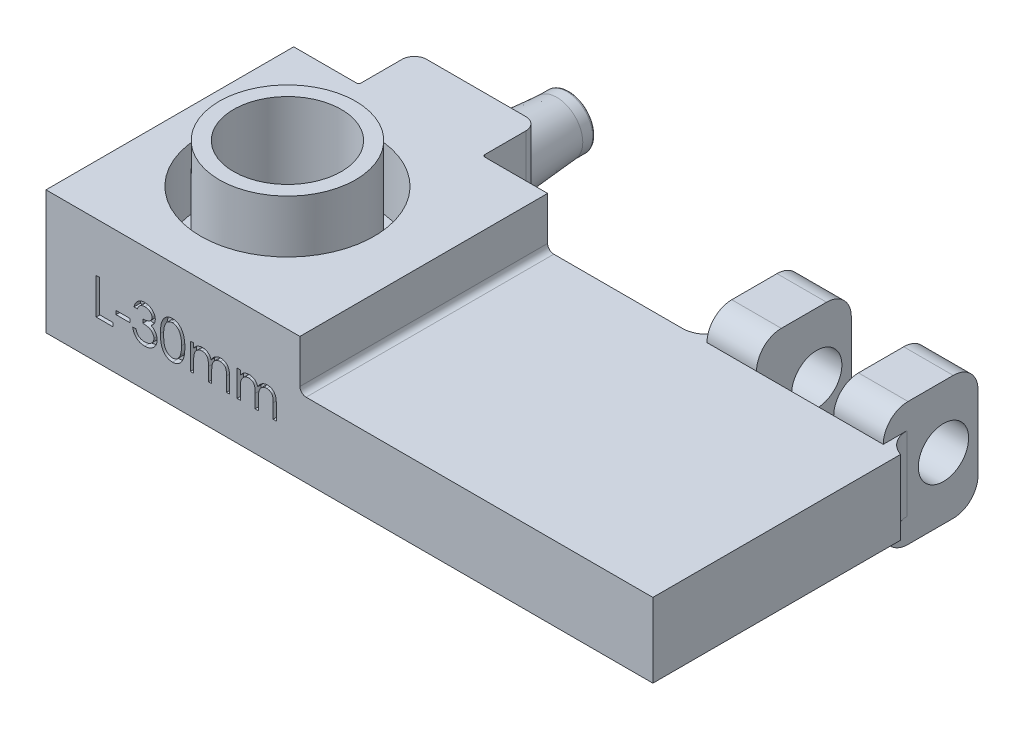
from build123d import *

# Parameters (mm, degrees)
SKETCH2_W            = 49
SKETCH2_H            = 20
BOSS_EXTRUDE1_DEPTH  = 10
SKETCH3_W            = 30
SKETCH3_H            = 3.02
CUT_EXTRUDE1_DEPTH   = 2
SKETCH4_W            = 5
SKETCH4_H            = 5
CUT_EXTRUDE2_DEPTH   = 5
SKETCH5_R            = 7
CUT_EXTRUDE3_DEPTH   = 38.474986727
SKETCH6_W            = 1.65
SKETCH6_H            = 5
BOSS_EXTRUDE2_DEPTH  = 0.5
SKETCH11_R           = 2
CUT_EXTRUDE4_DEPTH   = 2
SKETCH12_W           = 5
SKETCH12_H           = 5
BOSS_EXTRUDE4_DEPTH  = 0.8
SKETCH14_W           = 28.5
SKETCH14_H           = 4
CUT_EXTRUDE6_DEPTH   = 42.177221974
FILLET1_R            = 0.5
SKETCH13_W           = 1.119391026
SKETCH13_H           = 0.298504274
CUT_EXTRUDE5_DEPTH   = 0.5
SKETCH19_W           = 10
SKETCH19_H           = 4.49
BOSS_EXTRUDE5_DEPTH  = 10
FILLET2_R            = 1
CUT_EXTRUDE7_REACH   = 45.535
SKETCH20_R           = 0.5
SKETCH21_R           = 1.4
CUT_EXTRUDE8_DEPTH   = 10
FILLET3_R            = 0.2
BOSS_EXTRUDE6_START  = -0.5
SKETCH24_W           = 1.7
SKETCH24_H           = 3
BOSS_EXTRUDE6_DEPTH  = 0.5
SKETCH34_R           = 5.5
SKETCH34_R_2         = 4.35
BOSS_EXTRUDE10_DEPTH = 8.2
SKETCH36_W           = 4
SKETCH36_H           = 10
BOSS_EXTRUDE11_DEPTH = 7.65
CUT_EXTRUDE9_REACH   = 57.843
SKETCH37_R           = 2.03
FILLET4_R            = 2


with BuildPart() as part:
    # Sketch2 → Boss-Extrude1 (new body)
    with BuildSketch(Plane(origin=(0, 0, 0), x_dir=(1, 0, 0), z_dir=(0, 1, 0))):
        with Locations((10.076923077, 3.557692308)):
            Rectangle(SKETCH2_W, SKETCH2_H)
    extrude(amount=BOSS_EXTRUDE1_DEPTH)

    # Sketch3 → Cut-Extrude1 (cut)
    with BuildSketch(Plane.XZ):
        with Locations((12.576923077, -3.557692308)):
            Rectangle(SKETCH3_W, SKETCH3_H)
    extrude(amount=-CUT_EXTRUDE1_DEPTH, mode=Mode.SUBTRACT)

    # Sketch4 → Cut-Extrude2 (cut)
    with BuildSketch(Plane.XZ):
        with Locations((-4.923076923, -3.547692308)):
            Rectangle(SKETCH4_W, SKETCH4_H)
    extrude(amount=-CUT_EXTRUDE2_DEPTH, mode=Mode.SUBTRACT)

    # Sketch5 → Cut-Extrude3 (cut, through all)
    with BuildSketch(Plane.XZ.offset(-5)):
        with Locations(Location((-4.923076923, -3.552692308, 0), (0, 0, 270))):
            Circle(SKETCH5_R)
    extrude(amount=-CUT_EXTRUDE3_DEPTH, mode=Mode.SUBTRACT)

    # Sketch6 → Boss-Extrude2 (add)
    with BuildSketch(Plane(origin=(0, 5, 0), x_dir=(1, 0, 0), z_dir=(0, 1, 0))):
        with Locations((-3.248076923, 3.547692308)):
            Rectangle(SKETCH6_W, SKETCH6_H)
        with Locations((-6.598076923, 3.547692308)):
            Rectangle(SKETCH6_W, SKETCH6_H)
    extrude(amount=-BOSS_EXTRUDE2_DEPTH)

    # Sketch11 → Cut-Extrude4 (cut)
    with BuildSketch(Plane.XZ):
        with Locations((28.888372657, -3.557692308)):
            Circle(SKETCH11_R)
    extrude(amount=-CUT_EXTRUDE4_DEPTH, mode=Mode.SUBTRACT)

    # Sketch12 → Boss-Extrude4 (add)
    with BuildSketch(Plane.XZ):
        with Locations((-4.923076923, -3.547692308)):
            Rectangle(SKETCH12_W, SKETCH12_H)
    extrude(amount=-BOSS_EXTRUDE4_DEPTH)

    # Sketch14 → Cut-Extrude6 (cut, through all)
    with BuildSketch(Plane.XY.offset(6.442307692)):
        with Locations((20.326923077, 8)):
            Rectangle(SKETCH14_W, SKETCH14_H)
    extrude(amount=-CUT_EXTRUDE6_DEPTH, mode=Mode.SUBTRACT)

    # Fillet1
    fillet1_edges = [part.edges().sort_by_distance(p)[0] for p in [
        (6.076923077, 6, -3.557692308),
    ]]
    fillet(fillet1_edges, radius=FILLET1_R)

    # Sketch13 → Cut-Extrude5 (cut)
    # profile 1 of 6: a face of its own
    with BuildSketch(Plane.XY.offset(6.442307692)):
        Polygon((-10.374825021, 6.036177607), (-10.113633781, 6.036177607), (-10.113633781, 3.424265214), (-8.994242756, 3.424265214), (-8.994242756, 3.12576094), (-10.374825021, 3.12576094), align=None)
    # profile 2 of 6: a face of its own
    with BuildSketch(Plane.XY.offset(6.442307692)):
        with Locations((-8.210669038, 4.245151966)):
            Rectangle(SKETCH13_W, SKETCH13_H)
    # profile 3 of 6: a face of its own
    with BuildSketch(Plane.XY.offset(6.442307692)):
        with BuildLine():
            Line((-7.053964978, 5.364542992), (-7.315156217, 5.364542992))
            add(Edge.make_bspline(
                [(-7.315156217, 5.364542992), (-7.308080121, 5.39384048), (-7.294246931, 5.451114673), (-7.265394246, 5.532944996), (-7.233962365, 5.610381639), (-7.196219163, 5.681974624), (-7.155050277, 5.749162759), (-7.107882633, 5.810422144), (-7.056892363, 5.867310783), (-7.000492688, 5.917796731), (-6.941345819, 5.963513331), (-6.878618341, 6.002492173), (-6.81357228, 6.036023626), (-6.745756966, 6.063647831), (-6.674970501, 6.084457746), (-6.601852832, 6.099555994), (-6.52621235, 6.109360867), (-6.474866288, 6.110317781), (-6.448794205, 6.110803675)],
                knots=[0, 0, 0, 0, 1.162005537, 2.271625781, 3.343758855, 4.383309926, 5.390229558, 6.379919256, 7.361854164, 8.333198761, 9.295911338, 10.242430842, 11.177959212, 12.116337295, 13.062827104, 14.020064771, 14.994644689, 16, 16, 16, 16], degree=3))
            add(Edge.make_bspline(
                [(-6.448794205, 6.110803675), (-6.410806829, 6.10965678), (-6.335660693, 6.107388006), (-6.225261898, 6.086670465), (-6.118801501, 6.05388659), (-6.017444787, 6.008589092), (-5.923298269, 5.952719642), (-5.839531333, 5.886225155), (-5.767279399, 5.810388593), (-5.706664253, 5.726624669), (-5.659203673, 5.637103987), (-5.624206849, 5.54496838), (-5.602901202, 5.450436407), (-5.60014, 5.386609075), (-5.598756645, 5.354631717)],
                knots=[0, 0, 0, 0, 1.083050992, 2.142477498, 3.193116406, 4.255571735, 5.30263384, 6.308962982, 7.297363603, 8.282367274, 9.249857812, 10.179914175, 11.08814088, 12, 12, 12, 12], degree=3))
            add(Edge.make_bspline(
                [(-5.598756645, 5.354631717), (-5.599724226, 5.323858805), (-5.601617633, 5.263640992), (-5.617694529, 5.175728532), (-5.644749981, 5.092871797), (-5.682227635, 5.014721985), (-5.730741412, 4.941774604), (-5.789509125, 4.873865526), (-5.858945565, 4.810693554), (-5.911565015, 4.77450504), (-5.938655065, 4.755874122)],
                knots=[0, 0, 0, 0, 1.024540389, 2.004866551, 2.965041327, 3.920577974, 4.882998113, 5.874504559, 6.905732034, 8, 8, 8, 8], degree=3))
            add(Edge.make_bspline(
                [(-5.938655065, 4.755874122), (-5.907695089, 4.740924416), (-5.84635442, 4.711304725), (-5.762741866, 4.653216336), (-5.686839967, 4.586146742), (-5.6445111, 4.533806929), (-5.623243323, 4.507509238)],
                knots=[0, 0, 0, 0, 1.015518401, 2.012035669, 3.001164323, 4, 4, 4, 4], degree=3))
            add(Edge.make_bspline(
                [(-5.623243323, 4.507509238), (-5.609238945, 4.488335619), (-5.58145952, 4.450302364), (-5.54717021, 4.389153324), (-5.51606275, 4.32732652), (-5.491822955, 4.2631648), (-5.47305171, 4.197411823), (-5.459633831, 4.129954688), (-5.45129828, 4.060738309), (-5.45010455, 4.0139118), (-5.449504508, 3.990373905)],
                knots=[0, 0, 0, 0, 1.025084078, 2.033381695, 3.024893161, 4.013698104, 4.991890475, 5.976764909, 6.982997093, 8, 8, 8, 8], degree=3))
            add(Edge.make_bspline(
                [(-5.449504508, 3.990373905), (-5.450996731, 3.949619988), (-5.453974156, 3.868303942), (-5.480587068, 3.748166331), (-5.52184284, 3.630730601), (-5.580431137, 3.51840944), (-5.65183406, 3.413318135), (-5.736782739, 3.3192898), (-5.834311973, 3.238464532), (-5.943083099, 3.17093436), (-6.06092764, 3.116952016), (-6.186969962, 3.079484607), (-6.319393965, 3.055082011), (-6.410205034, 3.05246524), (-6.456373415, 3.051134872)],
                knots=[0, 0, 0, 0, 0.955779014, 1.907060117, 2.875433937, 3.871313158, 4.872415639, 5.851225146, 6.836215519, 7.83643374, 8.849228613, 9.86973379, 10.916971861, 12, 12, 12, 12], degree=3))
            add(Edge.make_bspline(
                [(-6.456373415, 3.051134872), (-6.487489345, 3.051856833), (-6.548715119, 3.053277411), (-6.638724743, 3.062988724), (-6.724641656, 3.080725639), (-6.806582024, 3.104593804), (-6.88461864, 3.13485527), (-6.958513375, 3.172539926), (-7.028720852, 3.216870978), (-7.094578551, 3.268371706), (-7.156078622, 3.325982439), (-7.211586691, 3.390725913), (-7.262028198, 3.461405302), (-7.306052523, 3.538841558), (-7.345664917, 3.622033953), (-7.378245749, 3.712047734), (-7.406922141, 3.808078198), (-7.42025473, 3.874999271), (-7.42709532, 3.909334658)],
                knots=[0, 0, 0, 0, 1.048658725, 2.063410685, 3.046034179, 4.001477787, 4.936774919, 5.862367409, 6.792675028, 7.730719943, 8.675894397, 9.627829632, 10.600096036, 11.597688215, 12.626045268, 13.701542398, 14.82072376, 16, 16, 16, 16], degree=3))
            Line((-7.42709532, 3.909334658), (-7.16590408, 3.909334658))
            add(Edge.make_bspline(
                [(-7.16590408, 3.909334658), (-7.159099284, 3.886925271), (-7.145863364, 3.843337065), (-7.123333165, 3.780604858), (-7.097664727, 3.723096644), (-7.070128394, 3.67039056), (-7.04120846, 3.621967544), (-7.008848847, 3.579108025), (-6.97544629, 3.539929491), (-6.950267566, 3.517856382), (-6.937944762, 3.507053509)],
                knots=[0, 0, 0, 0, 1.198163088, 2.33053128, 3.407730985, 4.417276592, 5.372219308, 6.28897303, 7.162600585, 8, 8, 8, 8], degree=3))
            add(Edge.make_bspline(
                [(-6.937944762, 3.507053509), (-6.921649276, 3.494490209), (-6.889108603, 3.469402391), (-6.836082282, 3.437386454), (-6.780314636, 3.409645173), (-6.720597315, 3.388454266), (-6.658218961, 3.370511414), (-6.592171324, 3.35876953), (-6.523037106, 3.350713354), (-6.475832008, 3.350002438), (-6.451709285, 3.349639146)],
                knots=[0, 0, 0, 0, 0.946170439, 1.889420265, 2.845303464, 3.807233317, 4.801018734, 5.828864929, 6.890507805, 8, 8, 8, 8], degree=3))
            add(Edge.make_bspline(
                [(-6.451709285, 3.349639146), (-6.424473188, 3.3501513), (-6.371215352, 3.351152774), (-6.293503186, 3.360362752), (-6.219572409, 3.373775959), (-6.150243852, 3.39449229), (-6.084609376, 3.420088034), (-6.02358904, 3.452226023), (-5.966381802, 3.489932319), (-5.913720385, 3.532789583), (-5.866367484, 3.579706743), (-5.824674091, 3.628778922), (-5.789229656, 3.679799216), (-5.760638073, 3.733049963), (-5.738061098, 3.78831065), (-5.722691436, 3.845736356), (-5.712004789, 3.904857118), (-5.711134482, 3.945044957), (-5.710695747, 3.96530421)],
                knots=[0, 0, 0, 0, 1.217147791, 2.380027433, 3.494444702, 4.572153297, 5.609568379, 6.639424714, 7.649109417, 8.668170816, 9.669597737, 10.625200337, 11.543417969, 12.441394052, 13.322311151, 14.205496177, 15.095365482, 16, 16, 16, 16], degree=3))
            add(Edge.make_bspline(
                [(-5.710695747, 3.96530421), (-5.711968266, 3.992422091), (-5.714506971, 4.046522918), (-5.733889165, 4.126116639), (-5.765769756, 4.202804798), (-5.810401005, 4.275278988), (-5.864730775, 4.342447997), (-5.928231831, 4.402378866), (-6.001431495, 4.451831079), (-6.068803374, 4.485998253), (-6.128479519, 4.509312417), (-6.179549336, 4.524841539), (-6.236723726, 4.537991347), (-6.299311279, 4.550225301), (-6.367783584, 4.560637398), (-6.442066097, 4.569320265), (-6.522173871, 4.57626788), (-6.577630751, 4.579370463), (-6.606208568, 4.580969274)],
                knots=[0, 0, 0, 0, 1.07054697, 2.135767047, 3.216561865, 4.33974944, 5.486079747, 6.621378074, 7.775625952, 8.963672916, 9.598146892, 10.304877434, 11.070270905, 11.915000392, 12.823868403, 13.805723172, 14.86925407, 16, 16, 16, 16], degree=3))
            Line((-6.606208568, 4.580969274), (-6.606208568, 4.879473547))
            add(Edge.make_bspline(
                [(-6.606208568, 4.879473547), (-6.570201586, 4.880084572), (-6.499672755, 4.881281418), (-6.396648741, 4.895757008), (-6.298132541, 4.915781197), (-6.206307446, 4.94645299), (-6.122613248, 4.982076737), (-6.050002841, 5.023531223), (-5.989493493, 5.069611226), (-5.941379257, 5.121027985), (-5.90518263, 5.176172105), (-5.878717133, 5.233645897), (-5.863083766, 5.293953107), (-5.860996859, 5.335110281), (-5.859947884, 5.355797749)],
                knots=[0, 0, 0, 0, 1.321986639, 2.589447074, 3.816329219, 5.01088745, 6.139805852, 7.153945165, 8.075214402, 8.924034688, 9.728124013, 10.488707548, 11.240355623, 12, 12, 12, 12], degree=3))
            add(Edge.make_bspline(
                [(-5.859947884, 5.355797749), (-5.860292486, 5.370996565), (-5.860978057, 5.401233887), (-5.869623888, 5.445409912), (-5.882616022, 5.488235401), (-5.90047744, 5.529528235), (-5.924384599, 5.569002028), (-5.952994815, 5.606993317), (-5.987061742, 5.643285198), (-6.026099116, 5.677112821), (-6.068018933, 5.709351287), (-6.113961752, 5.736720544), (-6.162542322, 5.760124503), (-6.21381443, 5.779424309), (-6.267944463, 5.793942539), (-6.324678095, 5.804366688), (-6.384123508, 5.810884071), (-6.424679526, 5.811822403), (-6.445296108, 5.812299402)],
                knots=[0, 0, 0, 0, 0.884392785, 1.759457502, 2.611959086, 3.489218968, 4.37281399, 5.2945488, 6.255912374, 7.266815255, 8.301784654, 9.332968512, 10.37626691, 11.440494194, 12.520033166, 13.637162961, 14.798855837, 16, 16, 16, 16], degree=3))
            add(Edge.make_bspline(
                [(-6.445296108, 5.812299402), (-6.478434667, 5.811142418), (-6.543161982, 5.80888256), (-6.636474029, 5.789089221), (-6.723220523, 5.757508636), (-6.789527021, 5.719812071), (-6.838490685, 5.682599955), (-6.873479663, 5.650101089), (-6.907839635, 5.613984628), (-6.939310118, 5.572026086), (-6.971136752, 5.527066976), (-7.000111664, 5.476821807), (-7.02826761, 5.422601248), (-7.045233302, 5.384270533), (-7.053964978, 5.364542992)],
                knots=[0, 0, 0, 0, 1.472543308, 2.876219568, 4.221790263, 5.565193594, 6.249813518, 6.953379497, 7.687249741, 8.463570142, 9.283606569, 10.136032583, 11.040678096, 12, 12, 12, 12], degree=3))
        make_face()
    # profile 4 of 6: a face of its own
    with BuildSketch(Plane.XY.offset(6.442307692)):
        with BuildLine():
            add(Edge.make_bspline(
                [(-5.188313269, 4.579803241), (-5.188040506, 4.626450891), (-5.18751066, 4.717064622), (-5.181616301, 4.849101613), (-5.171824543, 4.972969186), (-5.158405549, 5.088673272), (-5.142075633, 5.196243739), (-5.120276208, 5.295393117), (-5.095485443, 5.386580302), (-5.066753439, 5.470102648), (-5.034333236, 5.547085417), (-4.999047127, 5.618952087), (-4.959494735, 5.68559392), (-4.917936553, 5.748074571), (-4.872690324, 5.805371274), (-4.825043651, 5.858293179), (-4.773136889, 5.905617178), (-4.718734542, 5.948729847), (-4.661344065, 5.986523247), (-4.602601324, 6.019812376), (-4.542101989, 6.048251194), (-4.479680884, 6.070611872), (-4.415899054, 6.089081248), (-4.350533535, 6.101711582), (-4.283476401, 6.109658606), (-4.238214071, 6.110418364), (-4.215259299, 6.110803675)],
                knots=[0, 0, 0, 0, 1.646270934, 3.197905019, 4.663502075, 6.030701355, 7.308322542, 8.50163776, 9.611534131, 10.641858119, 11.616356847, 12.558055219, 13.465016945, 14.349605745, 15.204443733, 16.039544428, 16.859896111, 17.680448484, 18.487036065, 19.28249412, 20.06191084, 20.843045899, 21.620316918, 22.403196591, 23.190181807, 24, 24, 24, 24], degree=3))
            add(Edge.make_bspline(
                [(-4.215259299, 6.110803675), (-4.192112773, 6.110398034), (-4.146081616, 6.109591341), (-4.078027446, 6.101838038), (-4.011545479, 6.088973063), (-3.946919146, 6.070744729), (-3.883617594, 6.048130228), (-3.822135951, 6.019785167), (-3.762092324, 5.9867903), (-3.704440888, 5.948020325), (-3.648548735, 5.904794587), (-3.595788733, 5.85593063), (-3.546156078, 5.801921846), (-3.499027863, 5.743346081), (-3.455741155, 5.679079853), (-3.414518486, 5.610240924), (-3.377621025, 5.535625437), (-3.342085107, 5.456478345), (-3.311411821, 5.370609696), (-3.283749354, 5.278503523), (-3.261398212, 5.179071893), (-3.242780466, 5.072836491), (-3.228357359, 4.959407173), (-3.217852716, 4.839027088), (-3.212303728, 4.711617037), (-3.211258721, 4.624505897), (-3.210722457, 4.579803241)],
                knots=[0, 0, 0, 0, 0.810914788, 1.612654377, 2.396697861, 3.181598691, 3.963628158, 4.749916497, 5.551656086, 6.361998678, 7.18212741, 8.025565596, 8.878627764, 9.750805457, 10.657531673, 11.591944965, 12.560506719, 13.57287815, 14.630710178, 15.753379473, 16.941251878, 18.199788006, 19.531962791, 20.947069417, 22.433333509, 24, 24, 24, 24], degree=3))
            add(Edge.make_bspline(
                [(-3.210722457, 4.579803241), (-3.21126428, 4.535295563), (-3.212320001, 4.448574167), (-3.217790509, 4.321737398), (-3.228566228, 4.201996168), (-3.242045605, 4.089063301), (-3.26071465, 3.983408841), (-3.28366966, 3.884667177), (-3.309156863, 3.792411899), (-3.340618296, 3.707398785), (-3.375053274, 3.628441906), (-3.412518815, 3.554710949), (-3.452657474, 3.485554217), (-3.49638752, 3.421525261), (-3.542998602, 3.362170508), (-3.593488335, 3.308537664), (-3.646433458, 3.259334432), (-3.702490092, 3.215552097), (-3.76104065, 3.177230387), (-3.820878049, 3.142959108), (-3.883063993, 3.11532454), (-3.946189228, 3.091596294), (-4.011156685, 3.07346818), (-4.07788538, 3.060933552), (-4.146035893, 3.052142556), (-4.192104933, 3.05147193), (-4.215259299, 3.051134872)],
                knots=[0, 0, 0, 0, 1.561518951, 3.042555995, 4.452378317, 5.7783523, 7.031515105, 8.214008947, 9.334062868, 10.386615937, 11.391082383, 12.354592575, 13.286541444, 14.194233754, 15.072674879, 15.931287219, 16.775624067, 17.606195743, 18.42308326, 19.229000347, 20.022332153, 20.807536673, 21.593273796, 22.3848459, 23.188221202, 24, 24, 24, 24], degree=3))
            add(Edge.make_bspline(
                [(-4.215259299, 3.051134872), (-4.238213434, 3.051522669), (-4.283474508, 3.052287328), (-4.350540841, 3.060198449), (-4.41563642, 3.072917388), (-4.479082467, 3.090726315), (-4.541204492, 3.112525199), (-4.601155988, 3.140925614), (-4.659603544, 3.173633765), (-4.716391225, 3.210883291), (-4.770451932, 3.253559714), (-4.82208988, 3.300761924), (-4.870007827, 3.35366782), (-4.914607132, 3.411442021), (-4.956994513, 3.473553009), (-4.99598526, 3.540848805), (-5.03205019, 3.613062571), (-5.065015641, 3.690660857), (-5.094243428, 3.774775997), (-5.120061076, 3.866370284), (-5.140445765, 3.966252155), (-5.157894092, 4.073619394), (-5.171967522, 4.188933371), (-5.181575494, 4.312256688), (-5.187513837, 4.443512495), (-5.188041929, 4.533543968), (-5.188313269, 4.579803241)],
                knots=[0, 0, 0, 0, 0.810891512, 1.598919785, 2.382837074, 3.152667961, 3.926044502, 4.706494248, 5.493654104, 6.291793342, 7.103789334, 7.925228297, 8.761435821, 9.622817696, 10.50288917, 11.416980706, 12.369136599, 13.353924996, 14.394355917, 15.514179734, 16.714354668, 17.994756427, 19.357759367, 20.818452758, 22.365282078, 24, 24, 24, 24], degree=3))
        make_face()
        with BuildLine():
            add(Edge.make_bspline(
                [(-4.927122029, 4.580969274), (-4.927022703, 4.542095505), (-4.926829931, 4.466649152), (-4.921793912, 4.357015202), (-4.914933451, 4.254759518), (-4.906084706, 4.159752262), (-4.892943802, 4.072315019), (-4.878219764, 3.99184642), (-4.860301502, 3.918772312), (-4.83910118, 3.852591258), (-4.814953788, 3.792180098), (-4.788588853, 3.735966468), (-4.76026574, 3.683286317), (-4.728567851, 3.634612834), (-4.694046099, 3.589787291), (-4.65748024, 3.548016299), (-4.617505597, 3.510765476), (-4.562204568, 3.466089038), (-4.489197619, 3.419922234), (-4.397211443, 3.379720158), (-4.302690713, 3.354455699), (-4.238535775, 3.351242802), (-4.206514056, 3.349639146)],
                knots=[0, 0, 0, 0, 1.459021318, 2.831673884, 4.118529203, 5.306027144, 6.411944654, 7.436330062, 8.375795394, 9.233974572, 10.042671642, 10.816086306, 11.563610507, 12.285937304, 12.993564865, 13.685989202, 14.367179055, 15.041617293, 16.353048772, 17.594441528, 18.799311195, 20, 20, 20, 20], degree=3))
            add(Edge.make_bspline(
                [(-4.206514056, 3.349639146), (-4.174285207, 3.350967776), (-4.109894048, 3.353622295), (-4.01581791, 3.379232912), (-3.924488811, 3.417874547), (-3.852915894, 3.463566014), (-3.798464041, 3.507079512), (-3.759450329, 3.544178716), (-3.723642185, 3.585719399), (-3.689680055, 3.63053923), (-3.65853105, 3.679494504), (-3.630205929, 3.732349812), (-3.604358645, 3.789251932), (-3.58963273, 3.828974745), (-3.58210375, 3.849283994)],
                knots=[0, 0, 0, 0, 1.353760809, 2.704726607, 4.075137775, 5.516104923, 6.260822281, 7.007110065, 7.778089737, 8.566572457, 9.372053459, 10.217411131, 11.088608312, 12, 12, 12, 12], degree=3))
            add(Edge.make_bspline(
                [(-3.58210375, 3.849283994), (-3.573329453, 3.875253009), (-3.555513866, 3.927981248), (-3.532553361, 4.009775309), (-3.514471026, 4.095593321), (-3.498203156, 4.184922421), (-3.487099454, 4.278421387), (-3.478162135, 4.375800922), (-3.472897868, 4.477134447), (-3.47224531, 4.545982425), (-3.471913696, 4.580969274)],
                knots=[0, 0, 0, 0, 0.884706709, 1.796334032, 2.740027952, 3.714592787, 4.726048262, 5.777819803, 6.87074269, 8, 8, 8, 8], degree=3))
            add(Edge.make_bspline(
                [(-3.471913696, 4.580969274), (-3.472371204, 4.615950464), (-3.473266189, 4.684381149), (-3.476687166, 4.784597755), (-3.485521174, 4.879783149), (-3.495332703, 4.970347393), (-3.509799321, 5.055789163), (-3.52539733, 5.136823732), (-3.546353338, 5.212447188), (-3.568738413, 5.283843519), (-3.594358724, 5.350201563), (-3.622561272, 5.411830705), (-3.65268139, 5.46902848), (-3.685396336, 5.521637954), (-3.720317746, 5.569894777), (-3.758367327, 5.612831401), (-3.798035785, 5.651778571), (-3.853597457, 5.696235243), (-3.926336494, 5.741564313), (-4.016846833, 5.783279531), (-4.111036768, 5.807234999), (-4.174711241, 5.810612485), (-4.206514056, 5.812299402)],
                knots=[0, 0, 0, 0, 1.31362396, 2.569729283, 3.763502607, 4.902122613, 5.988968491, 7.01645872, 7.998833611, 8.933434873, 9.825090667, 10.667526885, 11.477055099, 12.250526234, 12.991942729, 13.710640831, 14.402115721, 15.076753259, 16.378508321, 17.609869233, 18.806226677, 20, 20, 20, 20], degree=3))
            add(Edge.make_bspline(
                [(-4.206514056, 5.812299402), (-4.238703757, 5.810610157), (-4.3031418, 5.807228591), (-4.398310725, 5.783368784), (-4.489535117, 5.741780621), (-4.562081805, 5.696085107), (-4.617682227, 5.652563309), (-4.656833729, 5.614822311), (-4.693543373, 5.573539086), (-4.727360503, 5.528301303), (-4.759033555, 5.479684566), (-4.788121933, 5.427306409), (-4.814330094, 5.3709014), (-4.83851527, 5.310517376), (-4.859780261, 5.244342031), (-4.877320896, 5.171357933), (-4.893525309, 5.091145277), (-4.904996732, 5.003234472), (-4.915194629, 4.908203419), (-4.921748345, 4.805692459), (-4.926846777, 4.695874637), (-4.927028441, 4.620038194), (-4.927122029, 4.580969274)],
                knots=[0, 0, 0, 0, 1.207732386, 2.417664972, 3.655092373, 4.956220595, 5.625982001, 6.301752483, 6.994047911, 7.697131622, 8.419323945, 9.170223765, 9.943494443, 10.752040957, 11.610060368, 12.549350801, 13.567764191, 14.679664412, 15.874934091, 17.154273443, 18.533957287, 20, 20, 20, 20], degree=3))
        make_face(mode=Mode.SUBTRACT)
    # profile 5 of 6: a face of its own
    with BuildSketch(Plane.XY.offset(6.442307692)):
        with BuildLine():
            Line((-2.762966046, 5.252603889), (-2.501774807, 5.252603889))
            Line((-2.501774807, 5.252603889), (-2.501774807, 4.882971644))
            add(Edge.make_bspline(
                [(-2.501774807, 4.882971644), (-2.478255356, 4.915308537), (-2.433189832, 4.977269123), (-2.359293811, 5.05891902), (-2.285472246, 5.128210349), (-2.232308594, 5.16458463), (-2.20676863, 5.182058934)],
                knots=[0, 0, 0, 0, 1.134379233, 2.173579362, 3.122582517, 4, 4, 4, 4], degree=3))
            add(Edge.make_bspline(
                [(-2.20676863, 5.182058934), (-2.17195617, 5.198694348), (-2.102939464, 5.231674535), (-1.993658121, 5.265130655), (-1.88183603, 5.285690755), (-1.806324675, 5.288502528), (-1.768340479, 5.289916923)],
                knots=[0, 0, 0, 0, 1.014936303, 2.012140481, 3.000054389, 4, 4, 4, 4], degree=3))
            add(Edge.make_bspline(
                [(-1.768340479, 5.289916923), (-1.742651481, 5.289047714), (-1.691814336, 5.287327596), (-1.616489351, 5.276134936), (-1.543430732, 5.256788005), (-1.473070137, 5.229839772), (-1.406778596, 5.197204283), (-1.346001448, 5.158911758), (-1.291431794, 5.115923178), (-1.243097214, 5.066297304), (-1.199633031, 5.00864062), (-1.15965318, 4.941398147), (-1.122711501, 4.86305999), (-1.10223771, 4.806209956), (-1.091458718, 4.776279687)],
                knots=[0, 0, 0, 0, 1.009824226, 1.998387844, 2.986035974, 3.974953746, 4.955485308, 5.885931332, 6.793869504, 7.679848016, 8.601185859, 9.625726857, 10.749998409, 12, 12, 12, 12], degree=3))
            add(Edge.make_bspline(
                [(-1.091458718, 4.776279687), (-1.080057159, 4.796839219), (-1.057620494, 4.837297491), (-1.019946699, 4.894556415), (-0.980474966, 4.948113729), (-0.938868902, 4.998011928), (-0.895275362, 5.044004603), (-0.849489186, 5.086243814), (-0.801771007, 5.124910956), (-0.73541996, 5.17008325), (-0.649094834, 5.21806453), (-0.540255134, 5.259665564), (-0.427039783, 5.285373797), (-0.350190066, 5.288392541), (-0.311383097, 5.289916923)],
                knots=[0, 0, 0, 0, 0.86119277, 1.694706429, 2.50939023, 3.298075842, 4.073795165, 4.829715201, 5.57930267, 6.321991688, 7.768977793, 9.186738141, 10.579381044, 12, 12, 12, 12], degree=3))
            add(Edge.make_bspline(
                [(-0.311383097, 5.289916923), (-0.275725119, 5.288572127), (-0.205938993, 5.285940231), (-0.104342778, 5.265273384), (-0.009594742, 5.229784888), (0.07811447, 5.181360846), (0.157244386, 5.120508871), (0.226026936, 5.048106986), (0.284044316, 4.964667317), (0.321945125, 4.886175883), (0.347652639, 4.816878586), (0.363502963, 4.757833473), (0.377505972, 4.692846735), (0.389132043, 4.621840667), (0.397629256, 4.544564441), (0.403924666, 4.461144518), (0.408185577, 4.371516065), (0.408486658, 4.309677611), (0.40864186, 4.277800871)],
                knots=[0, 0, 0, 0, 1.209669288, 2.367440248, 3.500751976, 4.631527125, 5.755587489, 6.87532382, 8.007944318, 9.190864318, 9.82315674, 10.514484317, 11.263564316, 12.079023757, 12.955305781, 13.901327259, 14.918167583, 16, 16, 16, 16], degree=3))
            Line((0.40864186, 4.277800871), (0.40864186, 3.12576094))
            Line((0.40864186, 3.12576094), (0.14745062, 3.12576094))
            Line((0.14745062, 3.12576094), (0.14745062, 4.278966903))
            add(Edge.make_bspline(
                [(0.14745062, 4.278966903), (0.147385857, 4.306175619), (0.147261392, 4.358466632), (0.145021509, 4.433515843), (0.140801143, 4.501925899), (0.135866209, 4.563603522), (0.129011089, 4.618692545), (0.120158489, 4.667082312), (0.110780561, 4.709153475), (0.095200693, 4.755791695), (0.070297595, 4.807239721), (0.032364488, 4.862723551), (-0.015424642, 4.911020502), (-0.070606272, 4.952945734), (-0.133428402, 4.987033898), (-0.202666984, 5.011378295), (-0.277892151, 5.026448331), (-0.329965981, 5.027950119), (-0.356858357, 5.028725684)],
                knots=[0, 0, 0, 0, 1.253487763, 2.409012846, 3.458416907, 4.410876679, 5.259312806, 6.014470957, 6.676830364, 7.243083969, 8.276244668, 9.299465089, 10.325150304, 11.392391894, 12.482080715, 13.603491619, 14.762376348, 16, 16, 16, 16], degree=3))
            add(Edge.make_bspline(
                [(-0.356858357, 5.028725684), (-0.389845813, 5.027548082), (-0.455041568, 5.025220692), (-0.550208439, 5.001460156), (-0.641654576, 4.965636876), (-0.726651327, 4.913721315), (-0.804839912, 4.851514598), (-0.872111763, 4.777548774), (-0.927685908, 4.693870197), (-0.965316744, 4.616414279), (-0.989090109, 4.546839152), (-1.004787164, 4.486055206), (-1.016997103, 4.416968926), (-1.028447954, 4.340044543), (-1.035921678, 4.254752553), (-1.042714068, 4.161487502), (-1.045891298, 4.059968876), (-1.046335725, 3.989597755), (-1.046566474, 3.95306087)],
                knots=[0, 0, 0, 0, 1.090531906, 2.155305635, 3.229839962, 4.33261226, 5.44038871, 6.529323825, 7.629011124, 8.757537029, 9.370236727, 10.061839251, 10.834451254, 11.692844982, 12.636905849, 13.66920014, 14.789842145, 16, 16, 16, 16], degree=3))
            Line((-1.046566474, 3.95306087), (-1.046566474, 3.12576094))
            Line((-1.046566474, 3.12576094), (-1.307757713, 3.12576094))
            Line((-1.307757713, 3.12576094), (-1.307757713, 4.207255916))
            add(Edge.make_bspline(
                [(-1.307757713, 4.207255916), (-1.307823764, 4.237768158), (-1.307950838, 4.296470644), (-1.310176324, 4.380651266), (-1.314406092, 4.457221069), (-1.319296048, 4.52609106), (-1.326331089, 4.587136075), (-1.334322064, 4.640683383), (-1.343758974, 4.686598741), (-1.359383658, 4.736960079), (-1.383261106, 4.792441704), (-1.421668845, 4.851598851), (-1.469572291, 4.903377739), (-1.525760692, 4.94758177), (-1.588963036, 4.984121204), (-1.658799233, 5.010447795), (-1.734640461, 5.025768469), (-1.786926268, 5.027721356), (-1.813815739, 5.028725684)],
                knots=[0, 0, 0, 0, 1.320475261, 2.540461679, 3.643808994, 4.639130445, 5.527981419, 6.302341397, 6.981980563, 7.553956391, 8.582137848, 9.585246428, 10.591171744, 11.620968678, 12.668337649, 13.738356861, 14.836885341, 16, 16, 16, 16], degree=3))
            add(Edge.make_bspline(
                [(-1.813815739, 5.028725684), (-1.845428029, 5.027453034), (-1.908430201, 5.024916687), (-2.000983089, 5.002087151), (-2.090362553, 4.966327215), (-2.17514274, 4.916717234), (-2.253037255, 4.855266631), (-2.321231034, 4.782992757), (-2.378560027, 4.700795078), (-2.416588209, 4.624155894), (-2.441117595, 4.556323831), (-2.457412049, 4.498655216), (-2.471415, 4.434625843), (-2.481821005, 4.364038168), (-2.491866446, 4.287351936), (-2.496714625, 4.204185126), (-2.501430799, 4.11460908), (-2.501657325, 4.052764767), (-2.501774807, 4.020690745)],
                knots=[0, 0, 0, 0, 1.098833095, 2.189935336, 3.297829714, 4.440610912, 5.596351641, 6.740013378, 7.886572111, 9.072425424, 9.705826452, 10.395263256, 11.156850408, 11.985370555, 12.878090359, 13.847760091, 14.883794034, 16, 16, 16, 16], degree=3))
            Line((-2.501774807, 4.020690745), (-2.501774807, 3.12576094))
            Line((-2.501774807, 3.12576094), (-2.762966046, 3.12576094))
            Line((-2.762966046, 3.12576094), (-2.762966046, 5.252603889))
        make_face()
    # profile 6 of 6: a face of its own
    with BuildSketch(Plane.XY.offset(6.442307692)):
        with BuildLine():
            Line((1.005650407, 5.252603889), (1.266841646, 5.252603889))
            Line((1.266841646, 5.252603889), (1.266841646, 4.882971644))
            add(Edge.make_bspline(
                [(1.266841646, 4.882971644), (1.290361097, 4.915308537), (1.335426621, 4.977269123), (1.409322642, 5.05891902), (1.483144207, 5.128210349), (1.536307859, 5.16458463), (1.561847823, 5.182058934)],
                knots=[0, 0, 0, 0, 1.134379233, 2.173579362, 3.122582517, 4, 4, 4, 4], degree=3))
            add(Edge.make_bspline(
                [(1.561847823, 5.182058934), (1.596660283, 5.198694348), (1.665676989, 5.231674535), (1.774958332, 5.265130655), (1.886780423, 5.285690755), (1.962291778, 5.288502528), (2.000275974, 5.289916923)],
                knots=[0, 0, 0, 0, 1.014936303, 2.012140481, 3.000054389, 4, 4, 4, 4], degree=3))
            add(Edge.make_bspline(
                [(2.000275974, 5.289916923), (2.025964972, 5.289047714), (2.076802117, 5.287327596), (2.152127102, 5.276134936), (2.225185721, 5.256788005), (2.295546316, 5.229839772), (2.361837857, 5.197204283), (2.422615005, 5.158911758), (2.477184659, 5.115923178), (2.525519239, 5.066297304), (2.568983422, 5.00864062), (2.608963273, 4.941398147), (2.645904952, 4.86305999), (2.666378743, 4.806209956), (2.677157735, 4.776279687)],
                knots=[0, 0, 0, 0, 1.009824226, 1.998387844, 2.986035974, 3.974953746, 4.955485308, 5.885931332, 6.793869504, 7.679848016, 8.601185859, 9.625726857, 10.749998409, 12, 12, 12, 12], degree=3))
            add(Edge.make_bspline(
                [(2.677157735, 4.776279687), (2.688559294, 4.796839219), (2.710995959, 4.837297491), (2.748669754, 4.894556415), (2.788141487, 4.948113729), (2.829747551, 4.998011928), (2.873341091, 5.044004603), (2.919127267, 5.086243814), (2.966845446, 5.124910956), (3.033196493, 5.17008325), (3.119521619, 5.21806453), (3.228361319, 5.259665564), (3.34157667, 5.285373797), (3.418426387, 5.288392541), (3.457233356, 5.289916923)],
                knots=[0, 0, 0, 0, 0.86119277, 1.694706429, 2.50939023, 3.298075842, 4.073795165, 4.829715201, 5.57930267, 6.321991688, 7.768977793, 9.186738141, 10.579381044, 12, 12, 12, 12], degree=3))
            add(Edge.make_bspline(
                [(3.457233356, 5.289916923), (3.492891334, 5.288572127), (3.56267746, 5.285940231), (3.664273675, 5.265273384), (3.759021711, 5.229784888), (3.846730923, 5.181360846), (3.925860839, 5.120508871), (3.994643389, 5.048106986), (4.052660769, 4.964667317), (4.090561578, 4.886175883), (4.116269092, 4.816878586), (4.132119416, 4.757833473), (4.146122425, 4.692846735), (4.157748496, 4.621840667), (4.166245709, 4.544564441), (4.172541119, 4.461144518), (4.17680203, 4.371516065), (4.177103111, 4.309677611), (4.177258313, 4.277800871)],
                knots=[0, 0, 0, 0, 1.209669288, 2.367440248, 3.500751976, 4.631527125, 5.755587489, 6.87532382, 8.007944318, 9.190864318, 9.82315674, 10.514484317, 11.263564316, 12.079023757, 12.955305781, 13.901327259, 14.918167583, 16, 16, 16, 16], degree=3))
            Line((4.177258313, 4.277800871), (4.177258313, 3.12576094))
            Line((4.177258313, 3.12576094), (3.916067073, 3.12576094))
            Line((3.916067073, 3.12576094), (3.916067073, 4.278966903))
            add(Edge.make_bspline(
                [(3.916067073, 4.278966903), (3.91600231, 4.306175619), (3.915877845, 4.358466632), (3.913637962, 4.433515843), (3.909417596, 4.501925899), (3.904482662, 4.563603522), (3.897627542, 4.618692545), (3.888774942, 4.667082312), (3.879397014, 4.709153475), (3.863817146, 4.755791695), (3.838914048, 4.807239721), (3.800980941, 4.862723551), (3.753191811, 4.911020502), (3.698010181, 4.952945734), (3.635188051, 4.987033898), (3.565949469, 5.011378295), (3.490724302, 5.026448331), (3.438650472, 5.027950119), (3.411758096, 5.028725684)],
                knots=[0, 0, 0, 0, 1.253487763, 2.409012846, 3.458416907, 4.410876679, 5.259312806, 6.014470957, 6.676830364, 7.243083969, 8.276244668, 9.299465089, 10.325150304, 11.392391894, 12.482080715, 13.603491619, 14.762376348, 16, 16, 16, 16], degree=3))
            add(Edge.make_bspline(
                [(3.411758096, 5.028725684), (3.37877064, 5.027548082), (3.313574885, 5.025220692), (3.218408014, 5.001460156), (3.126961877, 4.965636876), (3.041965126, 4.913721315), (2.963776541, 4.851514598), (2.89650469, 4.777548774), (2.840930545, 4.693870197), (2.803299709, 4.616414279), (2.779526344, 4.546839152), (2.763829289, 4.486055206), (2.75161935, 4.416968926), (2.740168499, 4.340044543), (2.732694775, 4.254752553), (2.725902385, 4.161487502), (2.722725155, 4.059968876), (2.722280728, 3.989597755), (2.722049979, 3.95306087)],
                knots=[0, 0, 0, 0, 1.090531906, 2.155305635, 3.229839962, 4.33261226, 5.44038871, 6.529323825, 7.629011124, 8.757537029, 9.370236727, 10.061839251, 10.834451254, 11.692844982, 12.636905849, 13.66920014, 14.789842145, 16, 16, 16, 16], degree=3))
            Line((2.722049979, 3.95306087), (2.722049979, 3.12576094))
            Line((2.722049979, 3.12576094), (2.46085874, 3.12576094))
            Line((2.46085874, 3.12576094), (2.46085874, 4.207255916))
            add(Edge.make_bspline(
                [(2.46085874, 4.207255916), (2.460792689, 4.237768158), (2.460665615, 4.296470644), (2.458440129, 4.380651266), (2.454210361, 4.457221069), (2.449320405, 4.52609106), (2.442285364, 4.587136075), (2.434294389, 4.640683383), (2.424857479, 4.686598741), (2.409232795, 4.736960079), (2.385355347, 4.792441704), (2.346947608, 4.851598851), (2.299044162, 4.903377739), (2.242855761, 4.94758177), (2.179653417, 4.984121204), (2.10981722, 5.010447795), (2.033975992, 5.025768469), (1.981690185, 5.027721356), (1.954800714, 5.028725684)],
                knots=[0, 0, 0, 0, 1.320475261, 2.540461679, 3.643808994, 4.639130445, 5.527981419, 6.302341397, 6.981980563, 7.553956391, 8.582137848, 9.585246428, 10.591171744, 11.620968678, 12.668337649, 13.738356861, 14.836885341, 16, 16, 16, 16], degree=3))
            add(Edge.make_bspline(
                [(1.954800714, 5.028725684), (1.923188424, 5.027453034), (1.860186252, 5.024916687), (1.767633364, 5.002087151), (1.6782539, 4.966327215), (1.593473713, 4.916717234), (1.515579198, 4.855266631), (1.447385419, 4.782992757), (1.390056426, 4.700795078), (1.352028244, 4.624155894), (1.327498858, 4.556323831), (1.311204404, 4.498655216), (1.297201453, 4.434625843), (1.286795448, 4.364038168), (1.276750007, 4.287351936), (1.271901828, 4.204185126), (1.267185654, 4.11460908), (1.266959128, 4.052764767), (1.266841646, 4.020690745)],
                knots=[0, 0, 0, 0, 1.098833095, 2.189935336, 3.297829714, 4.440610912, 5.596351641, 6.740013378, 7.886572111, 9.072425424, 9.705826452, 10.395263256, 11.156850408, 11.985370555, 12.878090359, 13.847760091, 14.883794034, 16, 16, 16, 16], degree=3))
            Line((1.266841646, 4.020690745), (1.266841646, 3.12576094))
            Line((1.266841646, 3.12576094), (1.005650407, 3.12576094))
            Line((1.005650407, 3.12576094), (1.005650407, 5.252603889))
        make_face()
    extrude(amount=-CUT_EXTRUDE5_DEPTH, mode=Mode.SUBTRACT)

    # Sketch19 → Boss-Extrude5 (add)
    with BuildSketch(Plane(origin=(0, 10, 0), x_dir=(1, 0, 0), z_dir=(0, 1, 0))):
        with Locations((-4.173076923, 15.802692308)):
            Rectangle(SKETCH19_W, SKETCH19_H)
    extrude(amount=-BOSS_EXTRUDE5_DEPTH)

    # Fillet2
    fillet2_edges = [part.edges().sort_by_distance(p)[0] for p in [
        (-9.173076923, 5, -18.047692308),
        (0.826923077, 5, -18.047692308),
    ]]
    fillet(fillet2_edges, radius=FILLET2_R)

    # Sketch20 → Cut-Extrude7 (cut, up to next)
    with BuildSketch(Plane(origin=(0, 0, -18.047692308), x_dir=(-1, 0, 0), z_dir=(0, 0, -1)), mode=Mode.PRIVATE) as cut_extrude7_sk1:
        with Locations((4.673076923, 3.5)):
            Circle(SKETCH20_R)
    cut_extrude7_tool1 = extrude(cut_extrude7_sk1.sketch, amount=-CUT_EXTRUDE7_REACH, mode=Mode.PRIVATE) & part.part
    add(cut_extrude7_tool1.solids().sort_by_distance((-4.673077, 3.5, -18.047692))[0], mode=Mode.SUBTRACT)

    # Sketch21 → Cut-Extrude8 (cut)
    with BuildSketch(Plane(origin=(0, 0, -18.047692308), x_dir=(-1, 0, 0), z_dir=(0, 0, -1))):
        with Locations((4.673076923, 3.5)):
            Circle(SKETCH21_R)
    extrude(amount=-CUT_EXTRUDE8_DEPTH, mode=Mode.SUBTRACT)

    # Sketch23 → Revolve1 (revolve)
    with BuildSketch(Plane(origin=(0, 3.5, 0), x_dir=(-1, 0, 0), z_dir=(0, -1, 0)), mode=Mode.PRIVATE) as revolve1_sk:
        with BuildLine():
            Line((6.273076923, 26.047692308), (6.773076923, 26.047692308))
            Line((6.773076923, 26.047692308), (6.773076923, 25.047692308))
            Line((6.773076923, 25.047692308), (7.173076923, 20.155841973))
            ThreePointArc((7.173076923, 20.155841973), (7.146945154, 20.079924198), (7.073409562, 20.047692308))
            Line((7.073409562, 20.047692308), (6.773076923, 20.047692308))
            Line((6.773076923, 20.047692308), (6.773076923, 18.047692308))
            Line((6.773076923, 18.047692308), (6.273076923, 18.047692308))
            Line((6.273076923, 18.047692308), (6.273076923, 26.047692308))
        make_face()
    revolve(revolve1_sk.sketch.rotate(Axis((-4.673076923, 3.5, -15.613069923), (0, 0, -1)), 180), axis=Axis((-4.673076923, 3.5, -15.613069923), (0, 0, -1)))

    # Fillet3
    fillet3_edges = [part.edges().sort_by_distance(p)[0] for p in [
        (-6.273076923, 3.5, -26.047692308),
        (-6.773076923, 3.5, -26.047692308),
        (-9.173076923, 5, -13.557692308),
        (0.826923077, 5, -13.557692308),
        (-6.773076923, 3.5, -18.047692308),
    ]]
    fillet(fillet3_edges, radius=FILLET3_R)

    # Sketch24 → Boss-Extrude6 (add)
    with BuildSketch(Plane(origin=(0, 5, 0), x_dir=(1, 0, 0), z_dir=(0, 1, 0)).offset(BOSS_EXTRUDE6_START)):
        with Locations((-4.923076923, 2.547692308)):
            Rectangle(SKETCH24_W, SKETCH24_H)
    extrude(amount=BOSS_EXTRUDE6_DEPTH)

    # Sketch34 → Boss-Extrude10 (add)
    with BuildSketch(Plane(origin=(0, 5, 0), x_dir=(1, 0, 0), z_dir=(0, 1, 0))):
        with Locations(Location((-4.923076923, 3.552692308, 0), (0, 0, 90))):
            Circle(SKETCH34_R)
        with Locations(Location((-4.923076923, 3.552692308, 0), (0, 0, 270))):
            Circle(SKETCH34_R_2, mode=Mode.SUBTRACT)
    extrude(amount=BOSS_EXTRUDE10_DEPTH)

    # Sketch36 → Boss-Extrude11 (add)
    with BuildSketch(Plane(origin=(0, 0, -13.557692308), x_dir=(-1, 0, 0), z_dir=(0, 0, -1))):
        with Locations((-31.176923077, 3)):
            Rectangle(SKETCH36_W, SKETCH36_H)
        with Locations((-20.946923077, 3)):
            Rectangle(SKETCH36_W, SKETCH36_H)
    extrude(amount=BOSS_EXTRUDE11_DEPTH)

    # Cut-Extrude9: up to this face of the body (flat: up to its plane)
    cut_extrude9_end = Plane(part.part.faces().sort_by_distance((18.946923077, 3, -17.382692308))[0])
    # Sketch37 → Cut-Extrude9 (cut, up to the picked face)
    with BuildSketch(Plane(origin=(33.176923077, 0, 0), x_dir=(0, 0, -1), z_dir=(1, 0, 0)), mode=Mode.PRIVATE) as cut_extrude9_sk1:
        with Locations((18.417692308, 3)):
            Circle(SKETCH37_R)
    cut_extrude9_tool1 = split(extrude(cut_extrude9_sk1.sketch, amount=-CUT_EXTRUDE9_REACH, mode=Mode.PRIVATE), bisect_by=cut_extrude9_end, keep=Keep.BOTH, mode=Mode.PRIVATE)
    add(cut_extrude9_tool1.solids().sort_by(Axis((33.176923, 3, -18.417692), (-1, 0, 0)))[0], mode=Mode.SUBTRACT)

    # Fillet4
    # the kernel refuses this fillet: 2 mm, written as the material it adds along each edge
    with BuildSketch(Plane(origin=(18.946923077, 0, -13.557692308), x_dir=(-1, 0, 0), z_dir=(0, 1, 0))) as fillet4_piece_1:
        with BuildLine():
            CenterArc((FILLET4_R, -FILLET4_R), FILLET4_R, 90, 90)
            Line((0, -FILLET4_R), (0, 0))
            Line((0, 0), (FILLET4_R, 0))
        make_face()
    extrude(amount=6)
    with BuildSketch(Plane(origin=(33.176923077, 6, -13.557692308), x_dir=(1, 0, 0), z_dir=(0, -1, 0))) as fillet4_piece_2:
        with BuildLine():
            CenterArc((2, -1.907878403), FILLET4_R, 107.457603124, 72.542396876)
            Line((0, -1.907878403), (0, 0))
            Line((0, 0), (1.4, 0))
        make_face()
    extrude(amount=6)
    # the kernel refuses this fillet: 2 mm, written as the material it takes off along each edge
    with BuildSketch(Plane(origin=(13.946923077, 8, -13.557692308), x_dir=(0, -1, 0), z_dir=(1, 0, 0)), Plane(origin=(13.946923077, 8, -21.207692308), x_dir=(0, 0, 1), z_dir=(1, 0, 0)), Plane(origin=(38.176923077, -2, -21.207692308), x_dir=(0, 0, 1), z_dir=(-1, 0, 0)), Plane(origin=(27.946923077, -2, -21.207692308), x_dir=(0, 0, 1), z_dir=(-1, 0, 0)), Plane(origin=(27.946923077, -2, -13.557692308), x_dir=(0, 1, 0), z_dir=(-1, 0, 0)), Plane(origin=(38.176923077, -2, -13.557692308), x_dir=(0, 1, 0), z_dir=(-1, 0, 0)), Plane(origin=(24.176923077, 8, -13.557692308), x_dir=(0, -1, 0), z_dir=(1, 0, 0)), Plane(origin=(24.176923077, 8, -21.207692308), x_dir=(0, 0, 1), z_dir=(1, 0, 0))) as fillet4_2_piece_1:
        with BuildLine():
            CenterArc((FILLET4_R, FILLET4_R), FILLET4_R, 180, 90)
            Line((0, FILLET4_R), (0, 0))
            Line((0, 0), (FILLET4_R, 0))
        make_face()
    extrude(amount=14, mode=Mode.SUBTRACT)


solid = part.part
